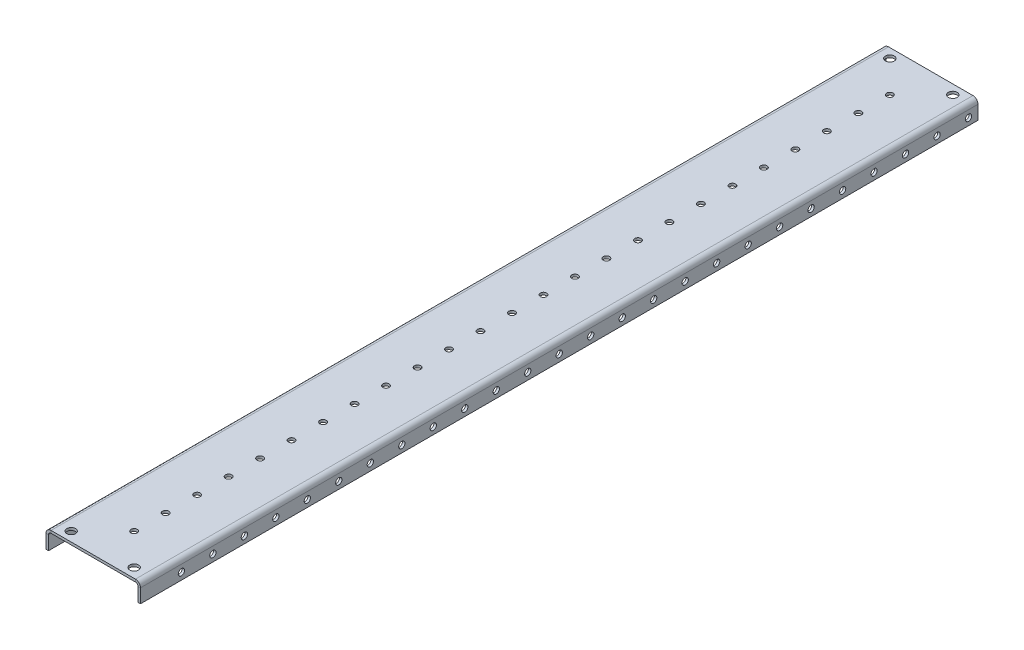
from build123d import *

# Parameters (mm, degrees)
SM_BASE_FLANGE_1_DEPTH = 332.5
SKETCH_6_R             = 2.5
CUT_EXTRUDE_1_DEPTH    = 342.183601599
SKETCH_7_R             = 2.5
CUT_EXTRUDE_2_DEPTH    = 10
SKETCH_8_R             = 3.5
CUT_EXTRUDE_3_DEPTH    = 10


# Sheet-metal steps are written as plain solids
with BuildPart() as part:
    # Sketch 1 → Базовая кромка1 (new, symmetric)
    with BuildSketch(Plane.XY):
        with BuildLine():
            Line((-37.5, -15), (-37.5, -4))
            ThreePointArc((-37.5, -4), (-36.328427125, -1.171572875), (-33.5, 0))
            Line((-33.5, 0), (33.5, 0))
            ThreePointArc((33.5, 0), (36.328427125, -1.171572875), (37.5, -4))
            Line((37.5, -4), (37.5, -15))
            Line((37.5, -15), (35.5, -15))
            Line((35.5, -15), (35.5, -4))
            ThreePointArc((35.5, -4), (34.914213562, -2.585786438), (33.5, -2))
            Line((33.5, -2), (-33.5, -2))
            ThreePointArc((-33.5, -2), (-34.914213562, -2.585786438), (-35.5, -4))
            Line((-35.5, -4), (-35.5, -15))
            Line((-35.5, -15), (-37.5, -15))
        make_face()
    extrude(amount=SM_BASE_FLANGE_1_DEPTH, both=True)

    # Эскиз6 → Вырез-Вытянуть1 (cut, through all)
    with BuildSketch(Plane(origin=(37.5, 0, 0), x_dir=(0, 0, -1), z_dir=(1, 0, 0))):
        with Locations((-300, -9.5)):
            Circle(SKETCH_6_R)
        with Locations((-275, -9.5)):
            Circle(SKETCH_6_R)
        with Locations((-250, -9.5)):
            Circle(SKETCH_6_R)
        with Locations((-225, -9.5)):
            Circle(SKETCH_6_R)
        with Locations((-200, -9.5)):
            Circle(SKETCH_6_R)
        with Locations((-175, -9.5)):
            Circle(SKETCH_6_R)
        with Locations((-150, -9.5)):
            Circle(SKETCH_6_R)
        with Locations((-125, -9.5)):
            Circle(SKETCH_6_R)
        with Locations((-100, -9.5)):
            Circle(SKETCH_6_R)
        with Locations((-75, -9.5)):
            Circle(SKETCH_6_R)
        with Locations((-50, -9.5)):
            Circle(SKETCH_6_R)
        with Locations((-25, -9.5)):
            Circle(SKETCH_6_R)
        with Locations((0, -9.5)):
            Circle(SKETCH_6_R)
        with Locations((25, -9.5)):
            Circle(SKETCH_6_R)
        with Locations((50, -9.5)):
            Circle(SKETCH_6_R)
        with Locations((75, -9.5)):
            Circle(SKETCH_6_R)
        with Locations((100, -9.5)):
            Circle(SKETCH_6_R)
        with Locations((125, -9.5)):
            Circle(SKETCH_6_R)
        with Locations((150, -9.5)):
            Circle(SKETCH_6_R)
        with Locations((175, -9.5)):
            Circle(SKETCH_6_R)
        with Locations((200, -9.5)):
            Circle(SKETCH_6_R)
        with Locations((225, -9.5)):
            Circle(SKETCH_6_R)
        with Locations((250, -9.5)):
            Circle(SKETCH_6_R)
        with Locations((275, -9.5)):
            Circle(SKETCH_6_R)
        with Locations((300, -9.5)):
            Circle(SKETCH_6_R)
        with Locations((325, -9.5)):
            Circle(SKETCH_6_R)
        with Locations((350, -9.5)):
            Circle(SKETCH_6_R)
        with Locations((375, -9.5)):
            Circle(SKETCH_6_R)
        with Locations((400, -9.5)):
            Circle(SKETCH_6_R)
        with Locations((425, -9.5)):
            Circle(SKETCH_6_R)
        with Locations((450, -9.5)):
            Circle(SKETCH_6_R)
        with Locations((475, -9.5)):
            Circle(SKETCH_6_R)
        with Locations((500, -9.5)):
            Circle(SKETCH_6_R)
        with Locations((525, -9.5)):
            Circle(SKETCH_6_R)
        with Locations((550, -9.5)):
            Circle(SKETCH_6_R)
        with Locations((575, -9.5)):
            Circle(SKETCH_6_R)
    extrude(amount=-CUT_EXTRUDE_1_DEPTH, mode=Mode.SUBTRACT)

    # Эскиз7 → Вырез-Вытянуть2 (cut)
    with BuildSketch(Plane(origin=(0, 0, 0), x_dir=(1, 0, 0), z_dir=(0, 1, 0))):
        with Locations(Location((0, 300, 0), (0, 0, 180))):
            Circle(SKETCH_7_R)
        with Locations(Location((0, 275, 0), (0, 0, 180))):
            Circle(SKETCH_7_R)
        with Locations(Location((0, 250, 0), (0, 0, 180))):
            Circle(SKETCH_7_R)
        with Locations(Location((0, 225, 0), (0, 0, 180))):
            Circle(SKETCH_7_R)
        with Locations(Location((0, 200, 0), (0, 0, 180))):
            Circle(SKETCH_7_R)
        with Locations(Location((0, 175, 0), (0, 0, 180))):
            Circle(SKETCH_7_R)
        with Locations(Location((0, 150, 0), (0, 0, 180))):
            Circle(SKETCH_7_R)
        with Locations(Location((0, 125, 0), (0, 0, 180))):
            Circle(SKETCH_7_R)
        with Locations(Location((0, 100, 0), (0, 0, 180))):
            Circle(SKETCH_7_R)
        with Locations(Location((0, 75, 0), (0, 0, 180))):
            Circle(SKETCH_7_R)
        with Locations(Location((0, 50, 0), (0, 0, 180))):
            Circle(SKETCH_7_R)
        with Locations(Location((0, 25, 0), (0, 0, 180))):
            Circle(SKETCH_7_R)
        with Locations(Location((0, 0, 0), (0, 0, 180))):
            Circle(SKETCH_7_R)
        with Locations(Location((0, -25, 0), (0, 0, 180))):
            Circle(SKETCH_7_R)
        with Locations(Location((0, -50, 0), (0, 0, 180))):
            Circle(SKETCH_7_R)
        with Locations(Location((0, -75, 0), (0, 0, 180))):
            Circle(SKETCH_7_R)
        with Locations(Location((0, -100, 0), (0, 0, 180))):
            Circle(SKETCH_7_R)
        with Locations(Location((0, -125, 0), (0, 0, 180))):
            Circle(SKETCH_7_R)
        with Locations(Location((0, -150, 0), (0, 0, 180))):
            Circle(SKETCH_7_R)
        with Locations(Location((0, -175, 0), (0, 0, 180))):
            Circle(SKETCH_7_R)
        with Locations(Location((0, -200, 0), (0, 0, 180))):
            Circle(SKETCH_7_R)
        with Locations(Location((0, -225, 0), (0, 0, 180))):
            Circle(SKETCH_7_R)
        with Locations(Location((0, -250, 0), (0, 0, 180))):
            Circle(SKETCH_7_R)
        with Locations(Location((0, -275, 0), (0, 0, 180))):
            Circle(SKETCH_7_R)
        with Locations(Location((0, -300, 0), (0, 0, 180))):
            Circle(SKETCH_7_R)
    extrude(amount=-CUT_EXTRUDE_2_DEPTH, mode=Mode.SUBTRACT)

    # Эскиз8 → Вырез-Вытянуть3 (cut)
    with BuildSketch(Plane(origin=(0, 0, 0), x_dir=(1, 0, 0), z_dir=(0, 1, 0))):
        with Locations(Location((25, 325, 0), (0, 0, 180))):
            Circle(SKETCH_8_R)
        with Locations(Location((-25, 325, 0), (0, 0, 180))):
            Circle(SKETCH_8_R)
        with Locations((-25, -325)):
            Circle(SKETCH_8_R)
        with Locations((25, -325)):
            Circle(SKETCH_8_R)
    extrude(amount=-CUT_EXTRUDE_3_DEPTH, mode=Mode.SUBTRACT)


solid = part.part
